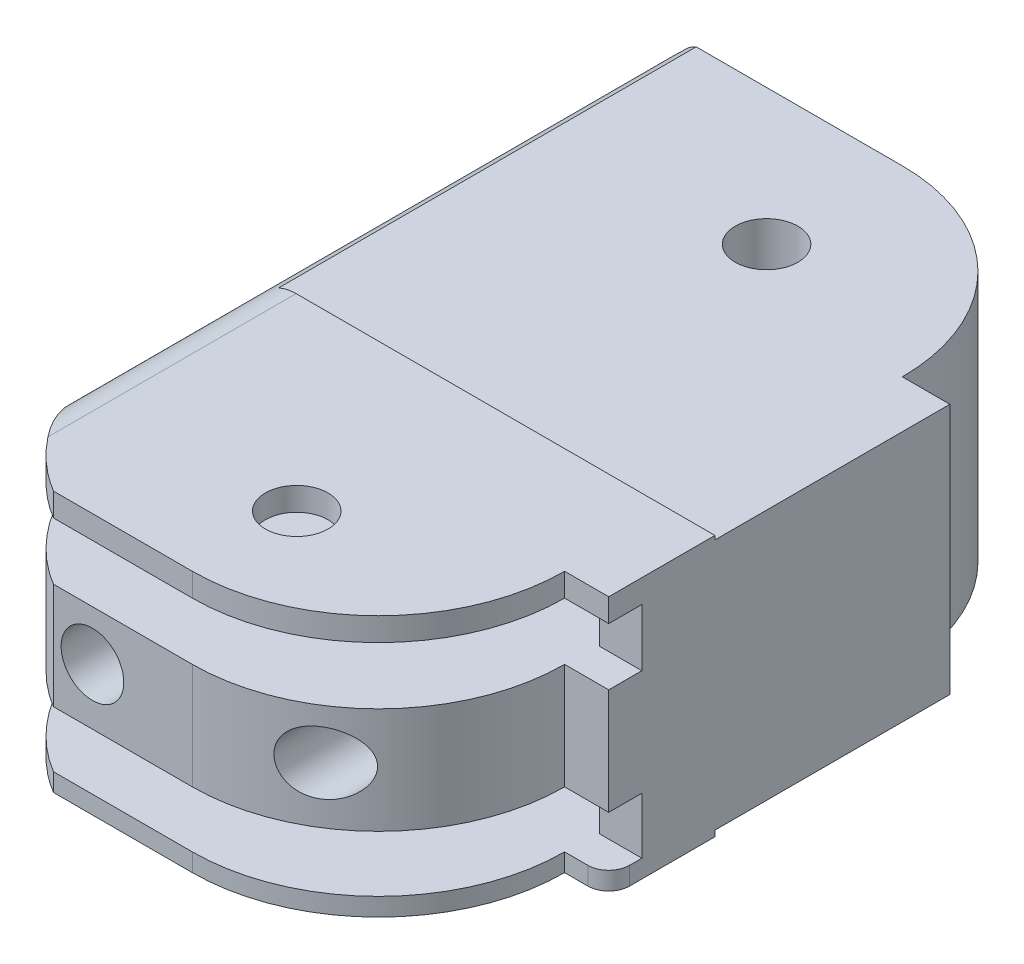
from build123d import *

# Parameters (mm, degrees)
SKETCH1_W               = 22.054431489
SKETCH1_H               = 12.5
BOSS_EXTRUDE1_DEPTH     = 34
CUT_EXTRUDE1_DEPTH      = 10
CUT_EXTRUDE1_DEPTH_BACK = 15
SKETCH2_R               = 1.5
FILLET3_R               = 2
SKETCH5_R               = 1.5
CUT_EXTRUDE4_DEPTH      = 52.610795679
SKETCH16_W              = 22.066089364
SKETCH16_H              = 2.745994046
SKETCH16_H_2            = 2.696035541
CUT_EXTRUDE6_DEPTH      = 14.5
FILLET4_R               = 1
SKETCH17_W              = 18.252824183
SKETCH17_H              = 2.745994046
SKETCH17_H_2            = 2.696035541
CUT_EXTRUDE7_DEPTH      = 5
SKETCH18_W              = 24.333833062
SKETCH18_H              = 0.605314718
SKETCH18_H_2            = 0.725933663
CUT_EXTRUDE8_DEPTH      = 20


with BuildPart() as part:
    # Sketch1 → Boss-Extrude1 (new body)
    with BuildSketch(Plane.XY):
        with Locations((-13.228930986, -24.070183414)):
            Rectangle(SKETCH1_W, SKETCH1_H)
    extrude(amount=BOSS_EXTRUDE1_DEPTH)

    # Sketch2 → Cut-Extrude1 (cut, two sides: drawn at the far end of the back side and taken through both)
    with BuildSketch(Plane.XZ.offset(30.320183414).offset(-CUT_EXTRUDE1_DEPTH_BACK)):
        with Locations(Location((-13.228930986, 6.5, 0), (0, 0, 90))):
            Circle(SKETCH2_R)
        with Locations(Location((-13.228930986, 29, 0), (0, 0, 90))):
            Circle(SKETCH2_R)
        with BuildLine():
            Line((-4.315096089, 25.086165103), (-2.201715242, 25.086165103))
            add(Edge.make_bspline(
                [(-24.256146731, 25.458595261), (-35.656041951, 36.540332573), (-13.006901701, 52.285060009), (9.32231541, 36.338450422), (-2.201715242, 25.086165103)],
                knots=[0, 0, 0, 0, 0.496841919, 1, 1, 1, 1], degree=3))
            add(Edge.make_bspline(
                [(-13.228930986, 34), (-19.086447972, 37.422293362), (-24.885707195, 30.868976401), (-24.256146731, 25.458595261)],
                knots=[0, 0, 0, 0, 1, 1, 1, 1], degree=3))
            ThreePointArc((-13.228930986, 34), (-6.925897884, 31.389198205), (-4.315096089, 25.086165103))
        make_face()
        with BuildLine():
            Line((-4.478930986, 8.75), (-2.201715242, 8.75))
            add(Edge.make_bspline(
                [(-2.201715242, 8.75), (5.39210746, 3.880294823), (-0.777052631, -4.523329032), (-17.174300591, -10.623347238), (-34.821400648, -0.026005424), (-24.256146731, 8.75)],
                knots=[0, 0, 0, 0, 0.283272691, 0.504244858, 1, 1, 1, 1], degree=3))
            add(Edge.make_bspline(
                [(-23.490579314, 0), (-24.966512963, 4.237786421), (-24.256146731, 8.75)],
                knots=[0, 0, 0, 1, 1, 1], degree=2))
            Line((-23.490579314, 0), (-13.228930986, 0))
            ThreePointArc((-13.228930986, 0), (-7.041746651, 2.562815665), (-4.478930986, 8.75))
        make_face()
    extrude(amount=CUT_EXTRUDE1_DEPTH + CUT_EXTRUDE1_DEPTH_BACK, mode=Mode.SUBTRACT)

    # Fillet3
    # the kernel refuses this fillet: 2 mm, written as the material it takes off along each edge
    with BuildSketch(Plane(origin=(-24.256146731, -17.820183414, -1.998495188), x_dir=(1, 0, 0), z_dir=(0, 0, 1))) as fillet3_piece_1:
        with BuildLine():
            CenterArc((FILLET3_R, -FILLET3_R), FILLET3_R, 90, 90)
            Line((0, -FILLET3_R), (0, 0))
            Line((0, 0), (FILLET3_R, 0))
        make_face()
    extrude(amount=34.125242274, mode=Mode.SUBTRACT)
    with BuildSketch(Plane(origin=(-24.256146731, -30.320183414, -1.998495188), x_dir=(1, 0, 0), z_dir=(0, 0, 1))) as fillet3_piece_2:
        with BuildLine():
            CenterArc((FILLET3_R, FILLET3_R), FILLET3_R, 180, 90)
            Line((0, FILLET3_R), (0, 0))
            Line((0, 0), (FILLET3_R, 0))
        make_face()
    extrude(amount=34.125242274, mode=Mode.SUBTRACT)
    with BuildSketch(Plane(origin=(-24.256146731, -17.374523396, 3.001504812), x_dir=(0.1667681859257429, 1.4874647964432132e-15, -0.9859961319209304), z_dir=(0, -1, 0))) as fillet3_piece_3:
        with BuildLine():
            CenterArc((0.168096911, 1.999974157), FILLET3_R, 260.400032587, 9.891234523)
            Line((-0.165439461, 0.027981894), (0, 0))
            ThreePointArc((0, 0), (0.089132004, -0.000226606), (0.178264007, 0))
        make_face()
    extrude(amount=13.331280444, mode=Mode.SUBTRACT)
    with BuildSketch(Plane(origin=(-24.256146731, -17.482274803, 27.126747086), x_dir=(0.11756979569322837, -1.02728794699617e-15, 0.9930646218351818), z_dir=(0, -1, 0))) as fillet3_piece_4:
        with BuildLine():
            CenterArc((0.118560979, -1.999931088), FILLET3_R, 89.524368939, 7.227500304)
            Line((-0.116578613, -0.013801845), (0, 0))
            ThreePointArc((0, 0), (0.067581725, 0.000281106), (0.135163444, 0))
        make_face()
    extrude(amount=13.131401648, mode=Mode.SUBTRACT)

    # Sketch5 → Cut-Extrude4 (cut, through all)
    with BuildSketch(Plane.XY):
        with Locations((-18.011106811, -24.070183414)):
            Circle(SKETCH5_R)
        with Locations(Location((-8.446755162, -24.070183414, 0), (0, 0, 180))):
            Circle(SKETCH5_R)
    extrude(amount=CUT_EXTRUDE4_DEPTH, mode=Mode.SUBTRACT)

    # Sketch16 → Cut-Extrude6 (cut)
    with BuildSketch(Plane.XY.offset(38)):
        with Locations((-13.228930985, -20.307980077)):
            Rectangle(SKETCH16_W, SKETCH16_H)
        with Locations((-13.228930985, -28.109934669)):
            Rectangle(SKETCH16_W, SKETCH16_H_2)
    extrude(amount=-CUT_EXTRUDE6_DEPTH, mode=Mode.SUBTRACT)

    # Fillet4
    fillet4_edges = [part.edges().sort_by_distance(p)[0] for p in [
        (-2.201715242, -29.889067926, 25.086165103),
    ]]
    fillet(fillet4_edges, radius=FILLET4_R)

    # Sketch17 → Cut-Extrude7 (cut)
    with BuildSketch(Plane.XY.offset(23.5)):
        with Locations((-13.345007216, -20.307980077)):
            Rectangle(SKETCH17_W, SKETCH17_H)
        with Locations((-13.345007216, -28.109934669)):
            Rectangle(SKETCH17_W, SKETCH17_H_2)
    extrude(amount=-CUT_EXTRUDE7_DEPTH, mode=Mode.SUBTRACT)

    # Sketch18 → Cut-Extrude8 (cut)
    with BuildSketch(Plane.XY):
        with Locations((-12.791033736, -17.704302546)):
            Rectangle(SKETCH18_W, SKETCH18_H)
        with Locations((-12.791033736, -30.407371646)):
            Rectangle(SKETCH18_W, SKETCH18_H_2)
    extrude(amount=CUT_EXTRUDE8_DEPTH, mode=Mode.SUBTRACT)


solid = part.part
